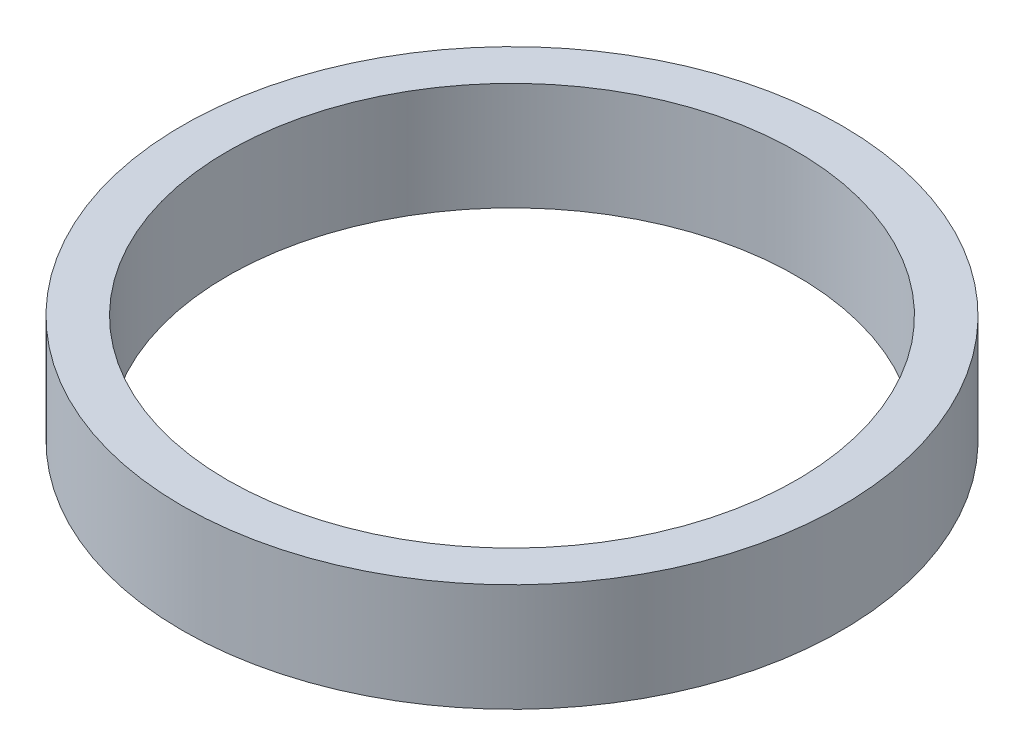
from build123d import *

# Parameters (mm, degrees)
SKETCH1_R           = 55
BOSS_EXTRUDE1_DEPTH = 18
SKETCH2_R           = 47.5
CUT_EXTRUDE1_DEPTH  = 80.837334625


with BuildPart() as part:
    # Sketch1 → Boss-Extrude1 (new body)
    with BuildSketch(Plane(origin=(0, 0, 0), x_dir=(1, 0, 0), z_dir=(0, 1, 0))):
        Circle(SKETCH1_R)
    extrude(amount=BOSS_EXTRUDE1_DEPTH)

    # Sketch2 → Cut-Extrude1 (cut, through all)
    with BuildSketch(Plane(origin=(0, 0, 0), x_dir=(1, 0, 0), z_dir=(0, 1, 0))):
        Circle(SKETCH2_R)
    extrude(amount=CUT_EXTRUDE1_DEPTH, mode=Mode.SUBTRACT)


solid = part.part
